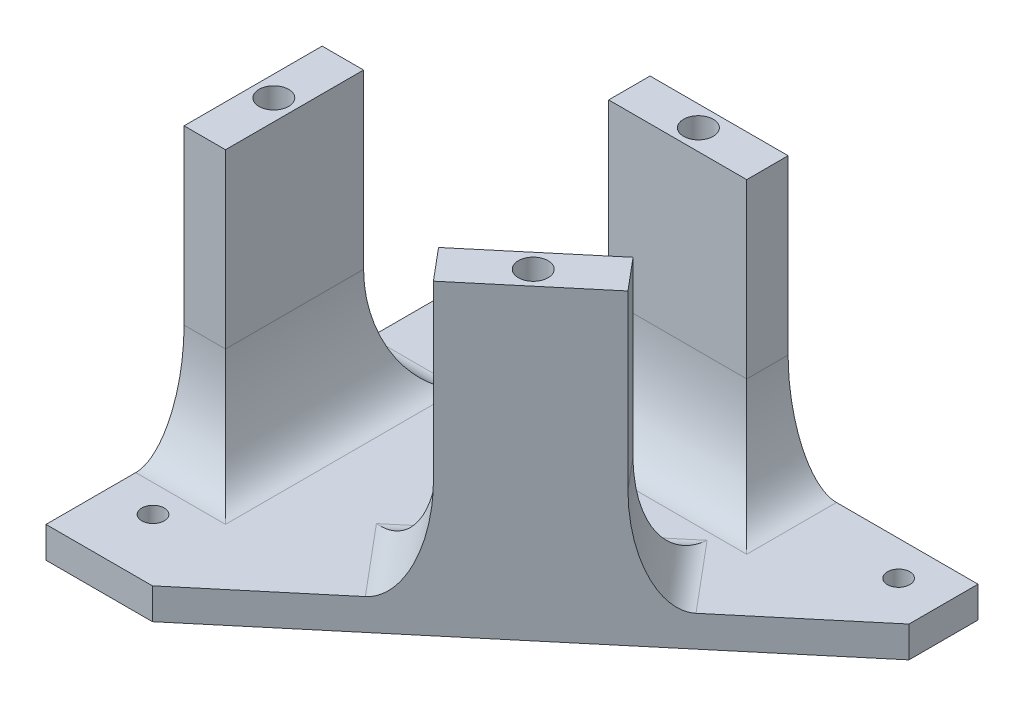
from build123d import *

# Parameters (mm, degrees)
SKETCH1_R           = 1.625
BOSS_EXTRUDE1_DEPTH = 4.5
SKETCH2_W           = 20
SKETCH2_H           = 6
SKETCH2_W_2         = 6
SKETCH2_H_2         = 20
BOSS_EXTRUDE2_DEPTH = 40
SKETCH3_R           = 2.15
CUT_EXTRUDE1_DEPTH  = 5
FILLET1_SIZE        = 7
FILLET1_SIZE_2      = 15


with BuildPart() as part:
    # Sketch1 → Boss-Extrude1 (new body)
    with BuildSketch(Plane(origin=(0, 0, 0), x_dir=(1, 0, 0), z_dir=(0, 1, 0))):
        Polygon((15.41232037, 0), (0, 0), (0, 60), (75, 60), (75, 50), align=None)
        with Locations(Location((68.5, 55, 0), (0, 0, 270))):
            Circle(SKETCH1_R, mode=Mode.SUBTRACT)
        with Locations(Location((6.5, 55, 0), (0, 0, 90))):
            Circle(SKETCH1_R, mode=Mode.SUBTRACT)
        with Locations(Location((6.5, 9, 0), (0, 0, 270))):
            Circle(SKETCH1_R, mode=Mode.SUBTRACT)
    extrude(amount=BOSS_EXTRUDE1_DEPTH)

    # Sketch2 → Boss-Extrude2 (add)
    with BuildSketch(Plane(origin=(0, 4.5, 0), x_dir=(1, 0, 0), z_dir=(0, 1, 0))):
        with Locations((37.5, 57)):
            Rectangle(SKETCH2_W, SKETCH2_H)
        with Locations((3, 30)):
            Rectangle(SKETCH2_W_2, SKETCH2_H_2)
        Polygon((52.866604616, 31.427876097), (37.545715754, 18.572123903), (33.688990096, 23.168390562), (49.009878958, 36.024142756), align=None)
    extrude(amount=BOSS_EXTRUDE2_DEPTH)

    # Sketch3 → Cut-Extrude1 (cut)
    with BuildSketch(Plane(origin=(0, 44.5, 0), x_dir=(1, 0, 0), z_dir=(0, 1, 0))):
        with Locations(Location((3, 30, 0), (0, 0, 270))):
            Circle(SKETCH3_R)
        with Locations(Location((37.5, 57, 0), (0, 0, 270))):
            Circle(SKETCH3_R)
        with Locations(Location((43.277797356, 27.298133329, 0), (0, 0, 270))):
            Circle(SKETCH3_R)
    extrude(amount=-CUT_EXTRUDE1_DEPTH, mode=Mode.SUBTRACT)

    # Fillet1
    # an asymmetric fillet: 15, 7 mm, written as the material it adds along each edge
    with BuildSketch(Plane(origin=(49.009878958, 4.5, -36.024142756), x_dir=(0.7660444431189766, 0, -0.642787609686541), z_dir=(0.6427876096865411, 0, 0.7660444431189767)), Plane(origin=(0, 4.5, -40), x_dir=(0, 0, -1), z_dir=(1, 0, 0)), Plane(origin=(37.545715754, 4.5, -18.572123903), x_dir=(-0.7660444431189747, 0, 0.6427876096865432), z_dir=(-0.6427876096865432, 0, -0.7660444431189748)), Plane(origin=(6, 4.5, -20), x_dir=(0, 0, 1), z_dir=(-1, 0, 0))) as fillet1_piece_1:
        with BuildLine():
            Bezier((FILLET1_SIZE, 0), (0, 0), (0, FILLET1_SIZE_2), weights=[1, 0.707106781, 1])
            Line((0, FILLET1_SIZE_2), (0, 0))
            Line((0, 0), (FILLET1_SIZE, 0))
        make_face()
    extrude(amount=6)
    with BuildSketch(Plane(origin=(27.5, 4.5, -60), x_dir=(-1, 0, 0), z_dir=(0, 0, 1)), Plane(origin=(47.5, 4.5, -54), x_dir=(1, 0, 0), z_dir=(0, 0, -1))) as fillet1_piece_2:
        with BuildLine():
            Bezier((FILLET1_SIZE, 0), (0, 0), (0, -FILLET1_SIZE_2), weights=[1, 0.707106781, 1])
            Line((0, -FILLET1_SIZE_2), (0, 0))
            Line((0, 0), (FILLET1_SIZE, 0))
        make_face()
    extrude(amount=6)
    with BuildSketch(Plane(origin=(33.688990096, 4.5, -23.168390562), x_dir=(-0.6427876096865404, 0, -0.7660444431189772), z_dir=(0.7660444431189771, 0, -0.6427876096865404)), Plane(origin=(6, 4.5, -40), x_dir=(1, 0, 0), z_dir=(0, 0, 1))) as fillet1_piece_3:
        with BuildLine():
            Bezier((FILLET1_SIZE, 0), (0, 0), (0, FILLET1_SIZE_2), weights=[1, 0.707106781, 1])
            Line((0, FILLET1_SIZE_2), (0, 0))
            Line((0, 0), (FILLET1_SIZE, 0))
        make_face()
    extrude(amount=20)
    with BuildSketch(Plane(origin=(27.5, 4.5, -54), x_dir=(0, 0, 1), z_dir=(1, 0, 0))) as fillet1_piece_4:
        with BuildLine():
            Bezier((FILLET1_SIZE, 0), (0, 0), (0, -FILLET1_SIZE_2), weights=[1, 0.707106781, 1])
            Line((0, -FILLET1_SIZE_2), (0, 0))
            Line((0, 0), (FILLET1_SIZE, 0))
        make_face()
    extrude(amount=20)
    with BuildSketch(Plane(origin=(33.688990096, 4.5, -23.168390562), x_dir=(-0.6427876096865404, 0, -0.7660444431189772), z_dir=(0.7660444431189771, 0, -0.6427876096865404))) as fillet1_piece_5a_section:
        with BuildLine():
            Bezier((FILLET1_SIZE, 0), (0, 0), (0, FILLET1_SIZE_2), weights=[1, 0.707106781, 1])
            Line((0, FILLET1_SIZE_2), (0, 0))
            Line((0, 0), (FILLET1_SIZE, 0))
        make_face()
    fillet1_piece_5a = extrude(amount=57.5, mode=Mode.PRIVATE)
    fillet1_piece_5a = split(fillet1_piece_5a, bisect_by=Plane(origin=(75, 8.294639166, -47.759587759), z_dir=(-1, 0, 0)), keep=Keep.TOP, mode=Mode.PRIVATE)
    fillet1_piece_5a = split(fillet1_piece_5a, bisect_by=Plane(origin=(60.829752449, 8.294639166, -60), z_dir=(0, 0, 1)), keep=Keep.TOP, mode=Mode.PRIVATE)
    fillet1_piece_5a = fillet1_piece_5a - Plane(origin=(68.5, 8.294639166, -55), x_dir=(0, 0, 1), z_dir=(0, -1, 0)) * Cylinder(1.625, 175, mode=Mode.PRIVATE)
    fillet1_piece_5a = split(fillet1_piece_5a, bisect_by=Plane(origin=(48.114987345, 8.294639166, -37.09063305), z_dir=(0.7660444431189766, 0, -0.642787609686541)), keep=Keep.TOP, mode=Mode.PRIVATE)
    with BuildSketch(Plane(origin=(24.905343595, 4.5, -64.750809373), x_dir=(0.7660444431189766, 0, -0.6427876096865409), z_dir=(0.6427876096865411, 0, 0.7660444431189767))) as fillet1_piece_5b_section:
        with BuildLine():
            Bezier((FILLET1_SIZE, 0), (0, 0), (0, FILLET1_SIZE_2), weights=[1, 0.707106781, 1])
            Line((0, FILLET1_SIZE_2), (0, 0))
            Line((0, 0), (FILLET1_SIZE, 0))
        make_face()
    fillet1_piece_5b = extrude(amount=43.5, mode=Mode.PRIVATE)
    fillet1_piece_5b = split(fillet1_piece_5b, bisect_by=Plane(origin=(50.108066505, 8.227156202, -36.945631521), z_dir=(-0.6427876096865404, 0, -0.7660444431189771)), keep=Keep.TOP, mode=Mode.PRIVATE)
    fillet1_piece_5 = fillet1_piece_5a & fillet1_piece_5b
    add(fillet1_piece_5)
    with BuildSketch(Plane(origin=(0, 4.5, -40), x_dir=(0, 0, -1), z_dir=(1, 0, 0))) as fillet1_piece_6a_section:
        with BuildLine():
            Bezier((FILLET1_SIZE, 0), (0, 0), (0, FILLET1_SIZE_2), weights=[1, 0.707106781, 1])
            Line((0, FILLET1_SIZE_2), (0, 0))
            Line((0, 0), (FILLET1_SIZE, 0))
        make_face()
    fillet1_piece_6a = extrude(amount=43.5, mode=Mode.PRIVATE)
    fillet1_piece_6a = split(fillet1_piece_6a, bisect_by=Plane(origin=(6, 8.227154746, -41.433583062), z_dir=(1, 0, 0)), keep=Keep.TOP, mode=Mode.PRIVATE)
    with BuildSketch(Plane(origin=(6, 4.5, -77.5), x_dir=(1, 0, 0), z_dir=(0, 0, 1))) as fillet1_piece_6b_section:
        with BuildLine():
            Bezier((FILLET1_SIZE, 0), (0, 0), (0, FILLET1_SIZE_2), weights=[1, 0.707106781, 1])
            Line((0, FILLET1_SIZE_2), (0, 0))
            Line((0, 0), (FILLET1_SIZE, 0))
        make_face()
    fillet1_piece_6b = extrude(amount=57.5, mode=Mode.PRIVATE)
    fillet1_piece_6b = split(fillet1_piece_6b, bisect_by=Plane(origin=(7.535537535, 8.087590717, -60), z_dir=(0, 0, 1)), keep=Keep.TOP, mode=Mode.PRIVATE)
    fillet1_piece_6b = fillet1_piece_6b - Plane(origin=(6.5, 8.087590717, -55), x_dir=(0, 0, -1), z_dir=(0, -1, 0)) * Cylinder(1.625, 175, mode=Mode.PRIVATE)
    fillet1_piece_6b = split(fillet1_piece_6b, bisect_by=Plane(origin=(7.535537535, 8.087590717, -40), z_dir=(0, 0, -1)), keep=Keep.TOP, mode=Mode.PRIVATE)
    fillet1_piece_6 = fillet1_piece_6a & fillet1_piece_6b
    add(fillet1_piece_6)
    with BuildSketch(Plane(origin=(37.545715754, 4.5, -18.572123903), x_dir=(-0.7660444431189747, 0, 0.6427876096865432), z_dir=(-0.6427876096865432, 0, -0.7660444431189748))) as fillet1_piece_7a_section:
        with BuildLine():
            Bezier((FILLET1_SIZE, 0), (0, 0), (0, FILLET1_SIZE_2), weights=[1, 0.707106781, 1])
            Line((0, FILLET1_SIZE_2), (0, 0))
            Line((0, 0), (FILLET1_SIZE, 0))
        make_face()
    fillet1_piece_7a = extrude(amount=43.5, mode=Mode.PRIVATE)
    fillet1_piece_7a = split(fillet1_piece_7a, bisect_by=Plane(origin=(32.590801758, 8.227154758, -22.246901132), z_dir=(-0.6427876096865404, 0, -0.7660444431189771)), keep=Keep.TOP, mode=Mode.PRIVATE)
    with BuildSketch(Plane(origin=(4.962323479, 4.5, 0.936144801), x_dir=(-0.6427876096865404, 0, -0.7660444431189771), z_dir=(0.7660444431189771, 0, -0.6427876096865404))) as fillet1_piece_7b_section:
        with BuildLine():
            Bezier((FILLET1_SIZE, 0), (0, 0), (0, FILLET1_SIZE_2), weights=[1, 0.707106781, 1])
            Line((0, FILLET1_SIZE_2), (0, 0))
            Line((0, 0), (FILLET1_SIZE, 0))
        make_face()
    fillet1_piece_7b = extrude(amount=57.5, mode=Mode.PRIVATE)
    fillet1_piece_7b = split(fillet1_piece_7b, bisect_by=Plane(origin=(18.636133347, 8.197576352, 0), z_dir=(0, 0, -1)), keep=Keep.TOP, mode=Mode.PRIVATE)
    fillet1_piece_7b = fillet1_piece_7b - Plane(origin=(6.5, 8.197576352, -9), x_dir=(0, 0, 1), z_dir=(0, -1, 0)) * Cylinder(1.625, 175, mode=Mode.PRIVATE)
    fillet1_piece_7b = split(fillet1_piece_7b, bisect_by=Plane(origin=(32.760947063, 8.197576352, -24.27438918), z_dir=(-0.7660444431189748, 0, 0.6427876096865432)), keep=Keep.TOP, mode=Mode.PRIVATE)
    fillet1_piece_7 = fillet1_piece_7a & fillet1_piece_7b
    add(fillet1_piece_7)
    with BuildSketch(Plane(origin=(6, 4.5, -40), x_dir=(1, 0, 0), z_dir=(0, 0, 1))) as fillet1_piece_8a_section:
        with BuildLine():
            Bezier((FILLET1_SIZE, 0), (0, 0), (0, FILLET1_SIZE_2), weights=[1, 0.707106781, 1])
            Line((0, FILLET1_SIZE_2), (0, 0))
            Line((0, 0), (FILLET1_SIZE, 0))
        make_face()
    fillet1_piece_8a = extrude(amount=57.5, mode=Mode.PRIVATE)
    fillet1_piece_8a = split(fillet1_piece_8a, bisect_by=Plane(origin=(7.977246716, 8.859328902, 0), z_dir=(0, 0, -1)), keep=Keep.TOP, mode=Mode.PRIVATE)
    fillet1_piece_8a = fillet1_piece_8a - Plane(origin=(6.5, 8.859328902, -9), x_dir=(0, 0, 1), z_dir=(0, -1, 0)) * Cylinder(1.625, 175, mode=Mode.PRIVATE)
    fillet1_piece_8a = split(fillet1_piece_8a, bisect_by=Plane(origin=(7.977246716, 8.859328902, -20), z_dir=(0, 0, 1)), keep=Keep.TOP, mode=Mode.PRIVATE)
    with BuildSketch(Plane(origin=(43.5, 4.5, -20), x_dir=(0, 0, 1), z_dir=(-1, 0, 0))) as fillet1_piece_8b_section:
        with BuildLine():
            Bezier((FILLET1_SIZE, 0), (0, 0), (0, FILLET1_SIZE_2), weights=[1, 0.707106781, 1])
            Line((0, FILLET1_SIZE_2), (0, 0))
            Line((0, 0), (FILLET1_SIZE, 0))
        make_face()
    fillet1_piece_8b = extrude(amount=43.5, mode=Mode.PRIVATE)
    fillet1_piece_8b = split(fillet1_piece_8b, bisect_by=Plane(origin=(28.359375086, 8.347664515, -10.863868837), z_dir=(-0.6427876096865403, 0, -0.7660444431189773)), keep=Keep.TOP, mode=Mode.PRIVATE)
    fillet1_piece_8b = split(fillet1_piece_8b, bisect_by=Plane(origin=(6, 8.347664515, -18.654716418), z_dir=(1, 0, 0)), keep=Keep.TOP, mode=Mode.PRIVATE)
    fillet1_piece_8 = fillet1_piece_8a & fillet1_piece_8b
    add(fillet1_piece_8)
    with BuildSketch(Plane(origin=(-10, 4.5, -54), x_dir=(0, 0, 1), z_dir=(1, 0, 0))) as fillet1_piece_9a_section:
        with BuildLine():
            Bezier((FILLET1_SIZE, 0), (0, 0), (0, -FILLET1_SIZE_2), weights=[1, 0.707106781, 1])
            Line((0, -FILLET1_SIZE_2), (0, 0))
            Line((0, 0), (FILLET1_SIZE, 0))
        make_face()
    fillet1_piece_9a = extrude(amount=57.5, mode=Mode.PRIVATE)
    fillet1_piece_9a = split(fillet1_piece_9a, bisect_by=Plane(origin=(0, 8.13747617, -52.520587064), z_dir=(1, 0, 0)), keep=Keep.TOP, mode=Mode.PRIVATE)
    fillet1_piece_9a = fillet1_piece_9a - Plane(origin=(6.5, 8.13747617, -55), x_dir=(0, 0, -1), z_dir=(0, -1, 0)) * Cylinder(1.625, 175, mode=Mode.PRIVATE)
    fillet1_piece_9a = split(fillet1_piece_9a, bisect_by=Plane(origin=(27.5, 8.13747617, -52.520587064), z_dir=(-1, 0, 0)), keep=Keep.TOP, mode=Mode.PRIVATE)
    with BuildSketch(Plane(origin=(27.5, 4.5, -60), x_dir=(-1, 0, 0), z_dir=(0, 0, 1))) as fillet1_piece_9b_section:
        with BuildLine():
            Bezier((FILLET1_SIZE, 0), (0, 0), (0, -FILLET1_SIZE_2), weights=[1, 0.707106781, 1])
            Line((0, -FILLET1_SIZE_2), (0, 0))
            Line((0, 0), (FILLET1_SIZE, 0))
        make_face()
    fillet1_piece_9b = extrude(amount=43.5, mode=Mode.PRIVATE)
    fillet1_piece_9b = split(fillet1_piece_9b, bisect_by=Plane(origin=(26.066416938, 8.227154746, -54), z_dir=(0, 0, 1)), keep=Keep.TOP, mode=Mode.PRIVATE)
    fillet1_piece_9 = fillet1_piece_9a & fillet1_piece_9b
    add(fillet1_piece_9)
    with BuildSketch(Plane(origin=(47.5, 4.5, -16.5), x_dir=(1, 0, 0), z_dir=(0, 0, -1))) as fillet1_piece_10a_section:
        with BuildLine():
            Bezier((FILLET1_SIZE, 0), (0, 0), (0, -FILLET1_SIZE_2), weights=[1, 0.707106781, 1])
            Line((0, -FILLET1_SIZE_2), (0, 0))
            Line((0, 0), (FILLET1_SIZE, 0))
        make_face()
    fillet1_piece_10a = extrude(amount=43.5, mode=Mode.PRIVATE)
    fillet1_piece_10a = split(fillet1_piece_10a, bisect_by=Plane(origin=(55.243266099, 8.330588612, -33.422131871), z_dir=(-0.6427876096865403, 0, -0.7660444431189773)), keep=Keep.TOP, mode=Mode.PRIVATE)
    fillet1_piece_10a = split(fillet1_piece_10a, bisect_by=Plane(origin=(48.857795406, 8.330588612, -54), z_dir=(0, 0, 1)), keep=Keep.TOP, mode=Mode.PRIVATE)
    with BuildSketch(Plane(origin=(27.5, 4.5, -54), x_dir=(0, 0, 1), z_dir=(1, 0, 0))) as fillet1_piece_10b_section:
        with BuildLine():
            Bezier((FILLET1_SIZE, 0), (0, 0), (0, -FILLET1_SIZE_2), weights=[1, 0.707106781, 1])
            Line((0, -FILLET1_SIZE_2), (0, 0))
            Line((0, 0), (FILLET1_SIZE, 0))
        make_face()
    fillet1_piece_10b = extrude(amount=57.5, mode=Mode.PRIVATE)
    fillet1_piece_10b = split(fillet1_piece_10b, bisect_by=Plane(origin=(68.011756194, 8.150775734, -44.1361672), z_dir=(-0.6427876096865403, 0, -0.7660444431189773)), keep=Keep.TOP, mode=Mode.PRIVATE)
    fillet1_piece_10b = split(fillet1_piece_10b, bisect_by=Plane(origin=(75, 8.150775734, -52.5360496), z_dir=(-1, 0, 0)), keep=Keep.TOP, mode=Mode.PRIVATE)
    fillet1_piece_10b = fillet1_piece_10b - Plane(origin=(68.5, 8.150775734, -55), x_dir=(0, 0, 1), z_dir=(0, -1, 0)) * Cylinder(1.625, 175, mode=Mode.PRIVATE)
    fillet1_piece_10b = split(fillet1_piece_10b, bisect_by=Plane(origin=(47.5, 8.150775734, -52.5360496), z_dir=(1, 0, 0)), keep=Keep.TOP, mode=Mode.PRIVATE)
    fillet1_piece_10 = fillet1_piece_10a & fillet1_piece_10b
    add(fillet1_piece_10)


solid = part.part
